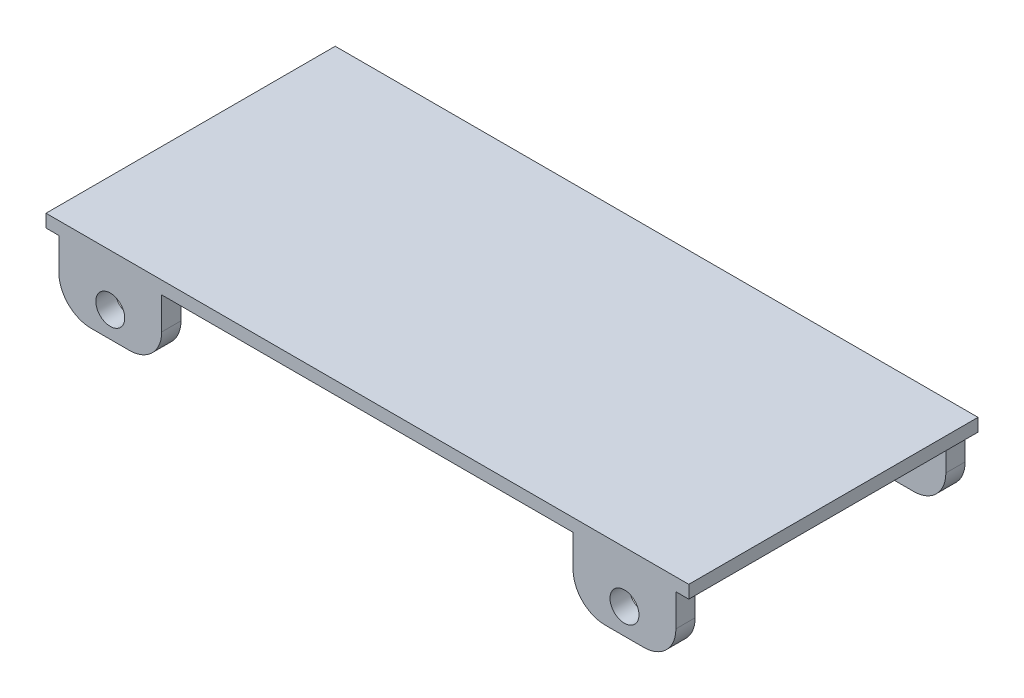
from build123d import *

# Parameters (mm, degrees)
SKETCH_1_W          = 100
SKETCH_1_H          = 45
EXTRUDE_1_DEPTH     = 2
SKETCH_2_W          = 16
SKETCH_2_H          = 3
EXTRUDE_2_DEPTH     = 10
SKETCH_3_R          = 2.25
CUT_EXTRUDE_1_DEPTH = 111.113577728
SKETCH_4_W          = 5
SKETCH_4_H          = 5
EXTRUDE_3_DEPTH     = 12
FILLET_1_R          = 5
FILLET_2_R          = 5
FILLET_3_R          = 2
SKETCH_5_W          = 1
SKETCH_5_H          = 5.209702161
CUT_EXTRUDE1_DEPTH  = 10


with BuildPart() as part:
    # 草图1 → 凸台-拉伸1 (new body)
    with BuildSketch(Plane(origin=(0, 0, 0), x_dir=(1, 0, 0), z_dir=(0, 1, 0))):
        with Locations((50, -22.5)):
            Rectangle(SKETCH_1_W, SKETCH_1_H)
    extrude(amount=EXTRUDE_1_DEPTH)

    # 草图2 → 凸台-拉伸2 (add)
    with BuildSketch(Plane(origin=(0, 0, 0), x_dir=(-1, 0, 0), z_dir=(0, -1, 0))):
        with Locations((-10, -43.5)):
            Rectangle(SKETCH_2_W, SKETCH_2_H)
        with Locations((-10, -1.5)):
            Rectangle(SKETCH_2_W, SKETCH_2_H)
        with Locations((-90, -43.5)):
            Rectangle(SKETCH_2_W, SKETCH_2_H)
        with Locations((-90, -1.5)):
            Rectangle(SKETCH_2_W, SKETCH_2_H)
    extrude(amount=EXTRUDE_2_DEPTH)

    # 草图3 → 切除-拉伸1 (cut, through all)
    with BuildSketch(Plane.XY.offset(45)):
        with Locations((90, -6)):
            Circle(SKETCH_3_R)
        with Locations((10, -6)):
            Circle(SKETCH_3_R)
    extrude(amount=-CUT_EXTRUDE_1_DEPTH, mode=Mode.SUBTRACT)

    # 草图4 → 凸台-拉伸3 (add)
    with BuildSketch(Plane(origin=(0, 0, 0), x_dir=(-1, 0, 0), z_dir=(0, -1, 0))):
        with Locations((-72.5, -22.5)):
            Rectangle(SKETCH_4_W, SKETCH_4_H)
    extrude(amount=EXTRUDE_3_DEPTH)

    # 圆角1
    fillet_1_edges = [part.edges().sort_by_distance(p)[0] for p in [
        (2, -10, 43.5),
        (18, -10, 43.5),
        (2, -10, 1.5),
        (18, -10, 1.5),
        (82, -10, 43.5),
        (98, -10, 43.5),
        (82, -10, 1.5),
        (98, -10, 1.5),
    ]]
    fillet(fillet_1_edges, radius=FILLET_1_R)

    # 圆角2
    fillet_2_edges = [part.edges().sort_by_distance(p)[0] for p in [
        (70, 0, 22.5),
    ]]
    fillet(fillet_2_edges, radius=FILLET_2_R)
    fillet_2_2_edges = [part.edges().sort_by_distance(p)[0] for p in [
        (70, -12, 22.5),
    ]]
    fillet(fillet_2_2_edges, radius=FILLET_2_R - 0.0001)  # a hair under: the kernel refuses the full size

    # 圆角3
    fillet_3_edges = [part.edges().sort_by_distance(p)[0] for p in [
        (10, 0, 42),
        (10, 0, 3),
        (90, 0, 42),
        (90, 0, 3),
    ]]
    fillet(fillet_3_edges, radius=FILLET_3_R)

    # 草图5 → Cut-Extrude1 (cut)
    with BuildSketch(Plane.XY.offset(25)):
        with Locations((74.5, -6.55317269)):
            Rectangle(SKETCH_5_W, SKETCH_5_H)
    extrude(amount=-CUT_EXTRUDE1_DEPTH, mode=Mode.SUBTRACT)


solid = part.part
